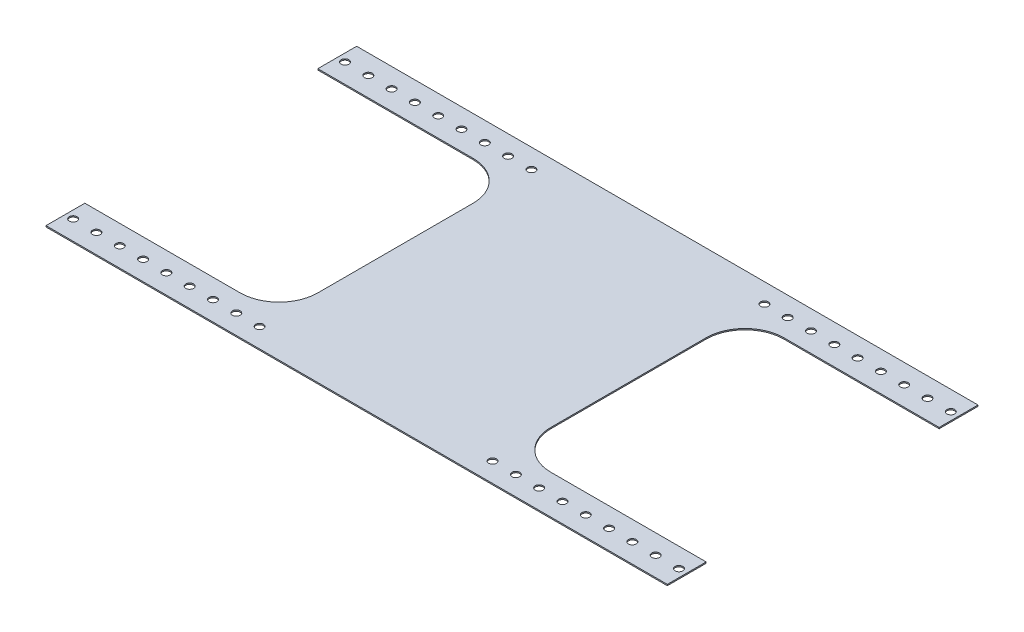
from build123d import *

# Parameters (mm, degrees)
SHEET_DEPTH             = 0.79375
SKETCH4_R               = 2.5
MOUNTHOLES_DEPTH        = 224.608206556
MIRROR4_COPY_1_SKETCH_R = 2.5
MIRROR4_COPY_1_DEPTH    = 224.608206556
MIRROR4_COPY_2_SKETCH_R = 2.5
MIRROR4_COPY_2_DEPTH    = 224.608206556


with BuildPart() as part:
    # Sketch3 → Sheet (new body)
    with BuildSketch(Plane(origin=(0, 0, 0), x_dir=(1, 0, 0), z_dir=(0, 1, 0))):
        with BuildLine():
            Line((-200, 100), (200, 100))
            Line((200, 100), (200, 75))
            Line((200, 75), (100, 75))
            ThreePointArc((100, 75), (82.32233047, 67.67766953), (75, 50))
            Line((75, 50), (75, -50))
            ThreePointArc((75, -50), (82.32233047, -67.67766953), (100, -75))
            Line((100, -75), (200, -75))
            Line((200, -75), (200, -100))
            Line((200, -100), (-200, -100))
            Line((-200, -100), (-200, -75))
            Line((-200, -75), (-100, -75))
            ThreePointArc((-100, -75), (-82.32233047, -67.67766953), (-75, -50))
            Line((-75, -50), (-75, 50))
            ThreePointArc((-75, 50), (-82.32233047, 67.67766953), (-100, 75))
            Line((-100, 75), (-200, 75))
            Line((-200, 75), (-200, 100))
        make_face()
    extrude(amount=SHEET_DEPTH)

    # Sketch4 → MountHoles (cut, through all)
    with BuildSketch(Plane(origin=(0, 0.79375, 0), x_dir=(1, 0, 0), z_dir=(0, 1, 0))):
        with Locations((-195, 87.5)):
            Circle(SKETCH4_R)
        with Locations((-180, 87.5)):
            Circle(SKETCH4_R)
        with Locations((-165, 87.5)):
            Circle(SKETCH4_R)
        with Locations((-150, 87.5)):
            Circle(SKETCH4_R)
        with Locations((-135, 87.5)):
            Circle(SKETCH4_R)
        with Locations((-120, 87.5)):
            Circle(SKETCH4_R)
        with Locations((-105, 87.5)):
            Circle(SKETCH4_R)
        with Locations((-90, 87.5)):
            Circle(SKETCH4_R)
        with Locations((-75, 87.5)):
            Circle(SKETCH4_R)
    mountholes = extrude(amount=-MOUNTHOLES_DEPTH, mode=Mode.SUBTRACT)

    # Mirror3: MountHoles across plane
    add(mountholes.mirror(Plane.XY), mode=Mode.SUBTRACT)

    # Mirror4 copy 1 sketch → Mirror4 copy 1 (cut, through all)
    with BuildSketch(Plane(origin=(0, 0.79375, 0), x_dir=(-1, 0, 0), z_dir=(0, 1, 0))):
        with Locations((-195, 87.5)):
            Circle(MIRROR4_COPY_1_SKETCH_R)
        with Locations((-180, 87.5)):
            Circle(MIRROR4_COPY_1_SKETCH_R)
        with Locations((-165, 87.5)):
            Circle(MIRROR4_COPY_1_SKETCH_R)
        with Locations((-150, 87.5)):
            Circle(MIRROR4_COPY_1_SKETCH_R)
        with Locations((-135, 87.5)):
            Circle(MIRROR4_COPY_1_SKETCH_R)
        with Locations((-120, 87.5)):
            Circle(MIRROR4_COPY_1_SKETCH_R)
        with Locations((-105, 87.5)):
            Circle(MIRROR4_COPY_1_SKETCH_R)
        with Locations((-90, 87.5)):
            Circle(MIRROR4_COPY_1_SKETCH_R)
        with Locations((-75, 87.5)):
            Circle(MIRROR4_COPY_1_SKETCH_R)
    extrude(amount=-MIRROR4_COPY_1_DEPTH, mode=Mode.SUBTRACT)

    # Mirror4 copy 2 sketch → Mirror4 copy 2 (cut, through all)
    with BuildSketch(Plane(origin=(0, 0.79375, 0), x_dir=(-1, 0, 0), z_dir=(0, 1, 0))):
        with Locations((-195, -87.5)):
            Circle(MIRROR4_COPY_2_SKETCH_R)
        with Locations((-180, -87.5)):
            Circle(MIRROR4_COPY_2_SKETCH_R)
        with Locations((-165, -87.5)):
            Circle(MIRROR4_COPY_2_SKETCH_R)
        with Locations((-150, -87.5)):
            Circle(MIRROR4_COPY_2_SKETCH_R)
        with Locations((-135, -87.5)):
            Circle(MIRROR4_COPY_2_SKETCH_R)
        with Locations((-120, -87.5)):
            Circle(MIRROR4_COPY_2_SKETCH_R)
        with Locations((-105, -87.5)):
            Circle(MIRROR4_COPY_2_SKETCH_R)
        with Locations((-90, -87.5)):
            Circle(MIRROR4_COPY_2_SKETCH_R)
        with Locations((-75, -87.5)):
            Circle(MIRROR4_COPY_2_SKETCH_R)
    extrude(amount=-MIRROR4_COPY_2_DEPTH, mode=Mode.SUBTRACT)


solid = part.part
